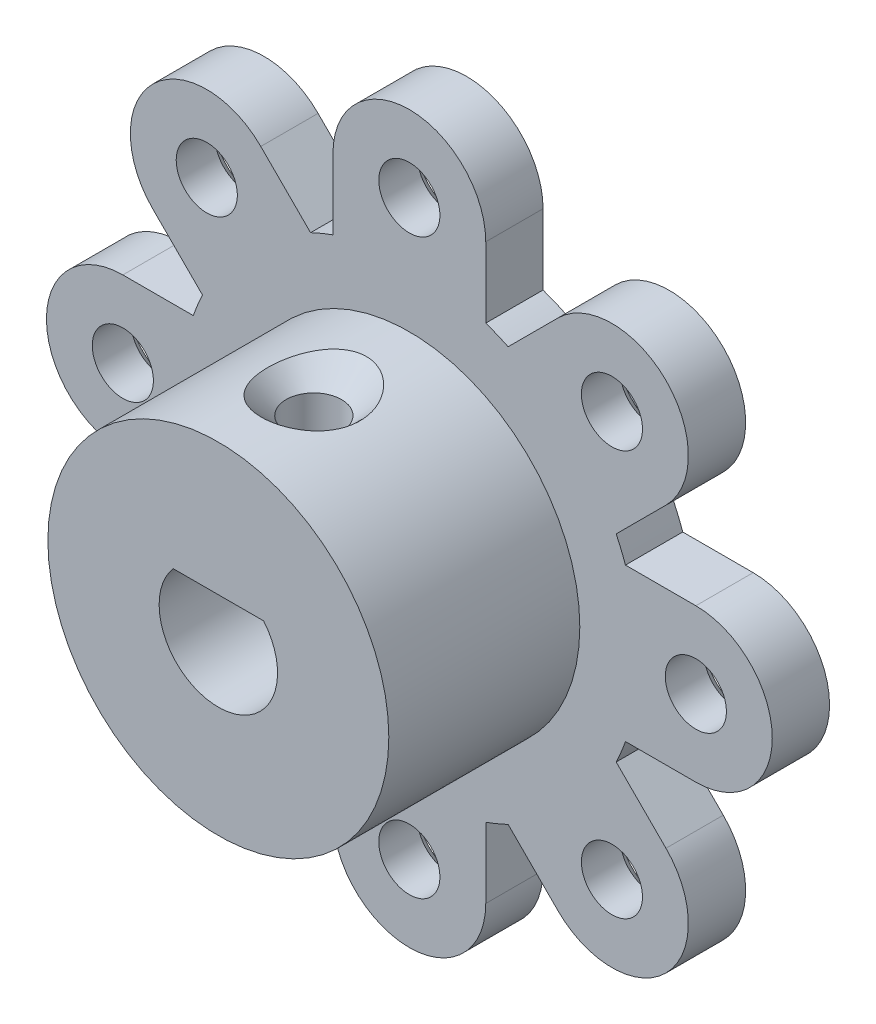
from build123d import *
from build123d.topology import SkipClean

# Parameters (mm, degrees)
MAIN_DEPTH                                        = 3
R_P_TITION_CIRCULAIRE1_COUNT                      = 8
ESQUISSE2_R                                       = 8.925
ESQUISSE2_R_2                                     = 3.1
MOTORLINK_DEPTH                                   = 10
MEPLAT_DEPTH                                      = 10
ESQUISSE4_R                                       = 3.1
HOLE_DEPTH                                        = 29.670542374
ESQUISSE5_R                                       = 4
ESQUISSE5_R_2                                     = 3.1
ROLLINGBEARINGLINK_DEPTH                          = 7
ESQUISSE6_R                                       = 5
ESQUISSE6_R_2                                     = 4
ROLLINGBEARLINK2_DEPTH                            = 0.5
FRAISAGE_POUR_VIS_T_TE_FRAIS_E_100_D              = 3.2
FRAISAGE_POUR_VIS_T_TE_FRAIS_E_100_CSINK_D        = 5.5
FRAISAGE_POUR_VIS_T_TE_FRAIS_E_100_CSINK_ANGLE    = 100
R_P_TITION_CIRCULAIRE2_COUNT                      = 8
CSK_FOR_M2_5_FLAT_HEAD_MACHINE_SCREW1_D           = 2.9
CSK_FOR_M2_5_FLAT_HEAD_MACHINE_SCREW1_CSINK_D     = 5.5
CSK_FOR_M2_5_FLAT_HEAD_MACHINE_SCREW1_CSINK_ANGLE = 90


with BuildPart() as part:
    # Esquisse1 → Main (new body)
    with BuildSketch(Plane.XY):
        with BuildLine():
            Line((11.313708499, 4), (15, 4))
            ThreePointArc((15, 4), (19, 0), (15, -4))
            Line((15, -4), (11.313708499, -4))
            ThreePointArc((11.313708499, -4), (11.204044803, -4.297601664), (11.08655439, -4.592201188))
            Line((11.08655439, -4.592201188), (0, 0))
            Line((0, 0), (11.08655439, 4.592201188))
            ThreePointArc((11.08655439, 4.592201188), (11.204044803, 4.297601664), (11.313708499, 4))
        make_face()
    main = extrude(amount=MAIN_DEPTH)

    # Répétition circulaire1: Main ×8 about axis
    r_p_tition_circulaire1_axis = Axis((0, 0, 11.883707709), (0, 0, -1))
    for i in range(1, R_P_TITION_CIRCULAIRE1_COUNT):
        add(main.rotate(r_p_tition_circulaire1_axis, i * 360 / R_P_TITION_CIRCULAIRE1_COUNT))

    # Esquisse2 → MotorLink (add)
    with BuildSketch(Plane.XY.offset(3)):
        Circle(ESQUISSE2_R)
        Circle(ESQUISSE2_R_2, mode=Mode.SUBTRACT)
    extrude(amount=MOTORLINK_DEPTH)

    # Esquisse3 → Meplat (add)
    with BuildSketch(Plane.XY.offset(3)):
        with BuildLine():
            Line((-2.368543856, 2), (2.368543856, 2))
            ThreePointArc((2.368543856, 2), (0, 3.1), (-2.368543856, 2))
        make_face()
    extrude(amount=MEPLAT_DEPTH)

    # Esquisse4 → Hole (cut, through all)
    with SkipClean():  # the faces are left unmerged after this step: merging them gives an invalid solid
        with BuildSketch(Plane.XY.offset(3)):
            Circle(ESQUISSE4_R)
        extrude(amount=-HOLE_DEPTH, mode=Mode.SUBTRACT)

    # Esquisse5 → RollingBearingLink (add)
    with SkipClean():  # the faces are left unmerged after this step: merging them gives an invalid solid
        with BuildSketch(Plane(origin=(0, 0, 0), x_dir=(-1, 0, 0), z_dir=(0, 0, -1))):
            Circle(ESQUISSE5_R)
            Circle(ESQUISSE5_R_2, mode=Mode.SUBTRACT)
        extrude(amount=ROLLINGBEARINGLINK_DEPTH)

    # Esquisse6 → RollingBearLink2 (add)
    with SkipClean():  # the faces are left unmerged after this step: merging them gives an invalid solid
        with BuildSketch(Plane(origin=(0, 0, 0), x_dir=(-1, 0, 0), z_dir=(0, 0, -1))):
            Circle(ESQUISSE6_R)
            Circle(ESQUISSE6_R_2, mode=Mode.SUBTRACT)
        extrude(amount=ROLLINGBEARLINK2_DEPTH)
    add(part.part.scale(1), mode=Mode.REPLACE)  # the faces are merged on a copy

    # Fraisage pour vis à tête fraisée (100) #01 (through all)
    with Locations(Plane(origin=(0, 0, 0), x_dir=(-1, 0, 0), z_dir=(0, 0, -1))):
        with Locations((15, 0)):
            fraisage_pour_vis_t_te_frais_e_100 = CounterSinkHole(FRAISAGE_POUR_VIS_T_TE_FRAIS_E_100_D / 2, FRAISAGE_POUR_VIS_T_TE_FRAIS_E_100_CSINK_D / 2, counter_sink_angle=FRAISAGE_POUR_VIS_T_TE_FRAIS_E_100_CSINK_ANGLE)

    # Répétition circulaire2: Fraisage pour vis à tête fraisée (100) #01 ×8 about axis
    r_p_tition_circulaire2_axis = Axis((0, 0, 11.883707709), (0, 0, -1))
    for i in range(1, R_P_TITION_CIRCULAIRE2_COUNT):
        add(fraisage_pour_vis_t_te_frais_e_100.rotate(r_p_tition_circulaire2_axis, i * 360 / R_P_TITION_CIRCULAIRE2_COUNT), mode=Mode.SUBTRACT)

    # CSK for M2.5 Flat Head Machine Screw1 (through all)
    with Locations(Plane(origin=(0, 8.925, 0), x_dir=(1, 0, 0), z_dir=(0, 1, 0))):
        with Locations((0, -8)):
            CounterSinkHole(CSK_FOR_M2_5_FLAT_HEAD_MACHINE_SCREW1_D / 2, CSK_FOR_M2_5_FLAT_HEAD_MACHINE_SCREW1_CSINK_D / 2, counter_sink_angle=CSK_FOR_M2_5_FLAT_HEAD_MACHINE_SCREW1_CSINK_ANGLE)


solid = part.part
